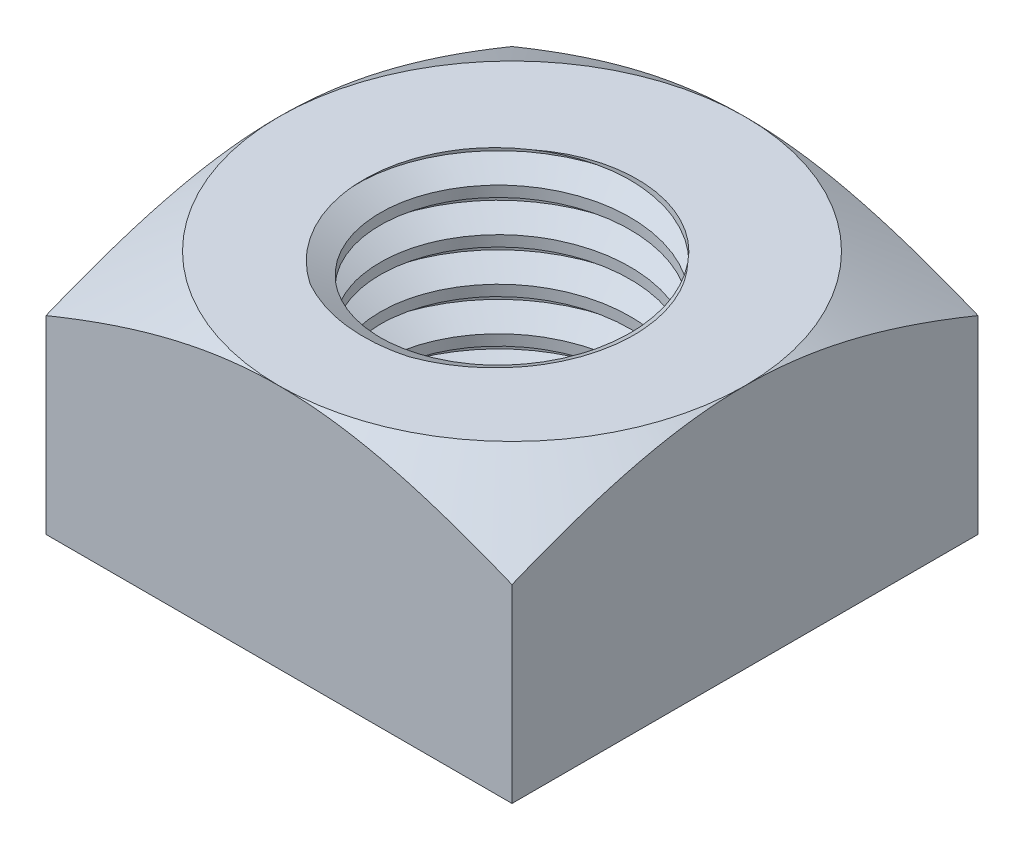
from build123d import *
from OCP.BRepAlgoAPI import BRepAlgoAPI_Cut
from OCP.TopTools import TopTools_ListOfShape

# Parameters (mm, degrees)
SKETCH1_W           = 19
SKETCH1_H           = 19
SKETCH1_R           = 5.1
BOSS_EXTRUDE1_DEPTH = 10
THREAD1_PITCH       = 1.75


with BuildPart() as part:
    # Sketch1 → Boss-Extrude1 (new body)
    with BuildSketch(Plane(origin=(0, 0, 0), x_dir=(1, 0, 0), z_dir=(0, 1, 0))):
        with Locations((9.5, 9.5)):
            Rectangle(SKETCH1_W, SKETCH1_H)
        with Locations(Location((9.5, 9.5, 0), (0, 0, 270))):
            Circle(SKETCH1_R, mode=Mode.SUBTRACT)
    extrude(amount=BOSS_EXTRUDE1_DEPTH)


with BuildPart() as cut_extrude1_tool:
    # Cut-Extrude1: read off the stored shape, not the designer's step
    # Cut-Extrude1 outline → Cut-Extrude1 (revolve)
    with BuildSketch(Plane(origin=(9.5, 0, -9.5), x_dir=(1, 0, 0), z_dir=(0, 0, 1))):
        Polygon((13.435028373, 10.000000176), (9.499999695, 10.000000176), (13.435028373, 7.728110309), align=None)
    revolve(axis=Axis((9.5, 0, -9.5), (0, 1, 0)))


with BuildPart() as part_1:
    add(part.part)

    # Cut-Extrude1: cut by cut_extrude1_tool, with a tolerance
    cut_extrude1_stock = TopTools_ListOfShape()
    cut_extrude1_stock.Append(part_1.part.wrapped)
    cut_extrude1_tools = TopTools_ListOfShape()
    cut_extrude1_tools.Append(cut_extrude1_tool.part.wrapped)
    cut_extrude1_cut = BRepAlgoAPI_Cut()
    cut_extrude1_cut.SetArguments(cut_extrude1_stock)
    cut_extrude1_cut.SetTools(cut_extrude1_tools)
    cut_extrude1_cut.SetFuzzyValue(0.00001)
    cut_extrude1_cut.Build()
    add(Compound.cast(cut_extrude1_cut.Shape()).solids(), mode=Mode.REPLACE)

    # Thread1: arcs per turn and ends read off the stored shape
    # Thread1: the profile of Thread Profile1 profile screwed along a right-hand helix through 6.857143 turns, 10 arcs to a turn; built about Z, then put on its axis
    thread1_z = Axis((0, 0, 0), (0, 0, 1))
    thread1_corners = [(5.0997, 0, -0.000173205), (6.047215281, 0, 0.546874998), (6.047215281, 0, 0.765624998), (5.0997, 0, 1.3126732)]
    with BuildLine(mode=Mode.PRIVATE) as thread1_profile:
        Line(thread1_corners[0], thread1_corners[1])
        Line(thread1_corners[1], thread1_corners[2])
        Line(thread1_corners[2], thread1_corners[3])
        Line(thread1_corners[3], thread1_corners[0])
    thread1_cap = Face(thread1_profile.wire())
    thread1_turn_angles = [0, 18, 36, 54, 72, 90, 108, 126, 144, 162, 180, 198, 216, 234, 252, 270, 288, 306, 324, 342, 360]
    thread1_turn_weights = [1, 0.9510565162951535, 1, 0.9510565162951535, 1, 0.9510565162951535, 1, 0.9510565162951535, 1, 0.9510565162951535, 1, 0.9510565162951535, 1, 0.9510565162951535, 1, 0.9510565162951535, 1, 0.9510565162951535, 1, 0.9510565162951535, 1]
    thread1_turn_rails = [Edge.make_bspline([Vector(p[0], p[1], 0).rotate(thread1_z, thread1_turn_angles[k]) / thread1_turn_weights[k] + Vector(0, 0, p[2] + THREAD1_PITCH * thread1_turn_angles[k] / 360) for k in range(21)], [0, 0, 0, 1, 1, 2, 2, 3, 3, 4, 4, 5, 5, 6, 6, 7, 7, 8, 8, 9, 9, 10, 10, 10], 2, thread1_turn_weights) for p in thread1_corners]
    thread1_turn_sides = [Face.make_surface_from_curves(thread1_turn_rails[p[0]], thread1_turn_rails[p[1]]) for p in [(0, 1), (1, 2), (2, 3), (3, 0)]]
    thread1_last_angles = [2160, 2178, 2196, 2214, 2232, 2250, 2268, 2286, 2304, 2322, 2340, 2358, 2376, 2394, 2412, 2430, 2448, 2458.285714286, 2468.571428571]
    thread1_last_weights = [1, 0.9510565162951535, 1, 0.9510565162951535, 1, 0.9510565162951535, 1, 0.9510565162951535, 1, 0.9510565162951535, 1, 0.9510565162951535, 1, 0.9510565162951535, 1, 0.9510565162951535, 1, 0.9839295885986299, 1]
    thread1_last_rails = [Edge.make_bspline([Vector(p[0], p[1], 0).rotate(thread1_z, thread1_last_angles[k]) / thread1_last_weights[k] + Vector(0, 0, p[2] + THREAD1_PITCH * thread1_last_angles[k] / 360) for k in range(19)], [0, 0, 0, 1, 1, 2, 2, 3, 3, 4, 4, 5, 5, 6, 6, 7, 7, 8, 8, 9, 9, 9], 2, thread1_last_weights) for p in thread1_corners]
    thread1_last_sides = [Face.make_surface_from_curves(thread1_last_rails[p[0]], thread1_last_rails[p[1]]) for p in [(0, 1), (1, 2), (2, 3), (3, 0)]]
    thread1 = Plane(origin=(9.5, 12, -9.5), x_dir=(-1, 0, 0), z_dir=(0, -1, 0)) * Solid(Shell([*[p.moved(Location((0, 0, THREAD1_PITCH * i))) for i in range(6) for p in thread1_turn_sides], *thread1_last_sides, thread1_cap, thread1_cap.rotate(thread1_z, 2468.571428571).moved(Location((0, 0, THREAD1_PITCH * 2468.571428571 / 360)))]))
    add(thread1, mode=Mode.SUBTRACT)


solid = part_1.part
